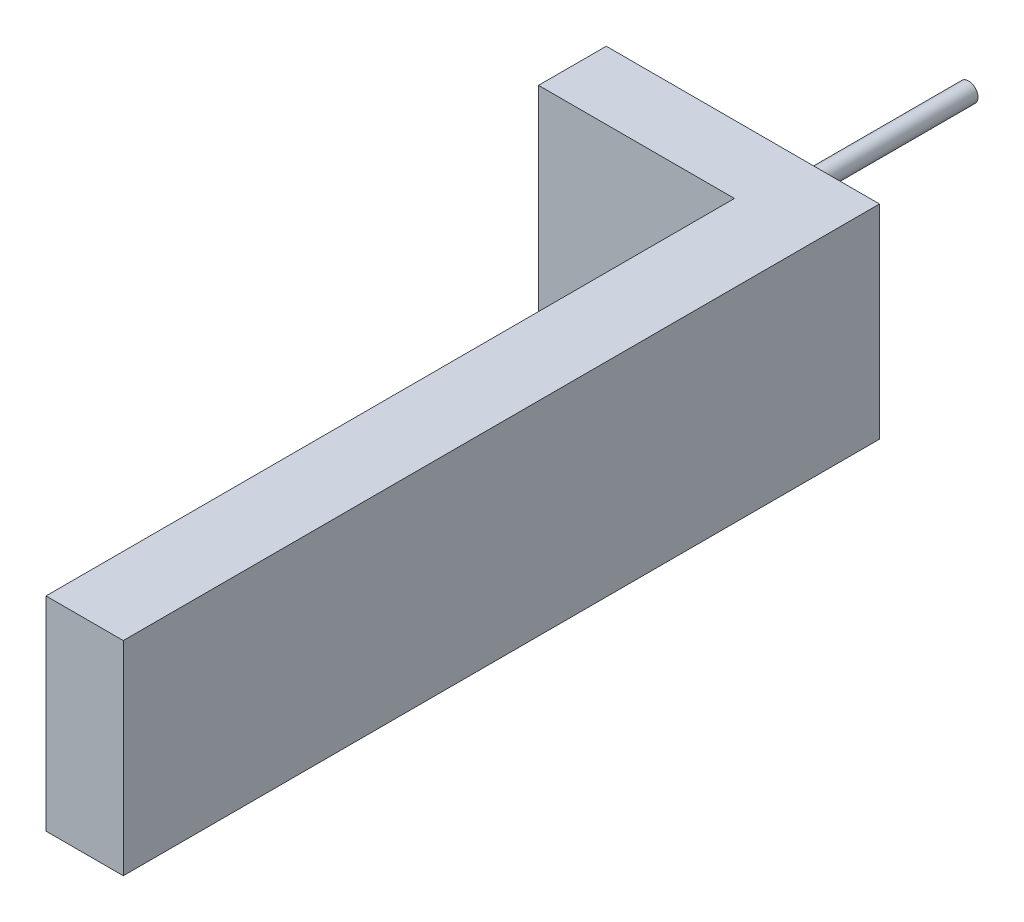
from build123d import *

# Parameters (mm, degrees)
SKETCH1_R           = 1.39
BOSS_EXTRUDE1_DEPTH = 35.306
SKETCH2_W           = 40.321108922
SKETCH2_H           = 30.063984723
SKETCH2_R           = 1.39
BOSS_EXTRUDE2_DEPTH = 10
SKETCH3_W           = 11.405344709
SKETCH3_H           = 30.063984723
BOSS_EXTRUDE3_DEPTH = 101.6
SCALE2_SCALE        = 10


with BuildPart() as part:
    # Sketch1 → Boss-Extrude1 (new body)
    with BuildSketch(Plane.XY):
        Circle(SKETCH1_R)
    extrude(amount=BOSS_EXTRUDE1_DEPTH)


with BuildPart() as body_2:
    # Sketch2 → Boss-Extrude2 (new body)
    with BuildSketch(Plane.XY.offset(35.306)):
        with Locations((1.995844364, -0.631596318)):
            Rectangle(SKETCH2_W, SKETCH2_H)
        Circle(SKETCH2_R, mode=Mode.SUBTRACT)
    extrude(amount=BOSS_EXTRUDE2_DEPTH)

    # Sketch3 → Boss-Extrude3 (add)
    with BuildSketch(Plane.XY.offset(45.306)):
        with Locations((16.453726471, -0.631596318)):
            Rectangle(SKETCH3_W, SKETCH3_H)
    extrude(amount=BOSS_EXTRUDE3_DEPTH)


with BuildPart() as body_2_1:
    # Scale2: scaled about (0, 0, 0)
    add(body_2.part.scale(SCALE2_SCALE))


with BuildPart() as part_1:
    # Scale2: scaled about (0, 0, 0)
    add(part.part.scale(SCALE2_SCALE))


solid = Compound([body_2_1.part, part_1.part])
